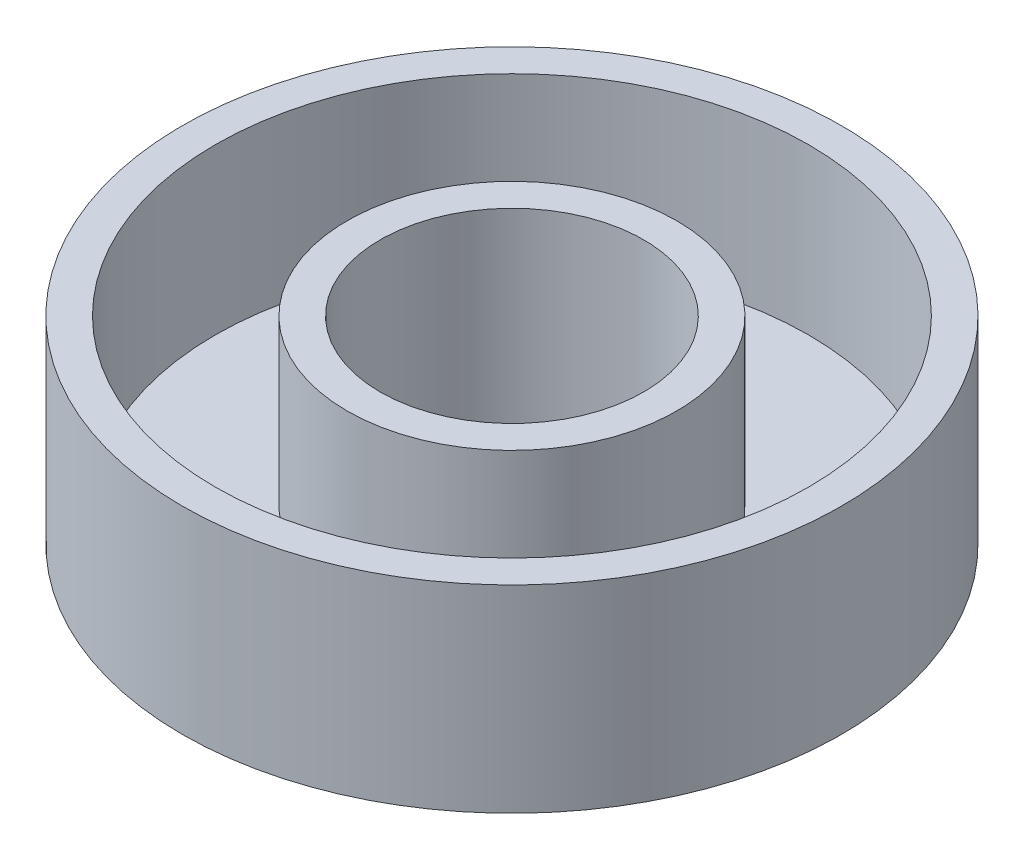
from build123d import *

# Parameters (mm, degrees)
SKETCH1_R            = 10
MAIN_EXTRUSION_DEPTH = 6
SKETCH2_R            = 4
ID_BORE_DEPTH        = 20
SKETCH3_R            = 9
SKETCH3_R_2          = 5
SEAL_RECESS_DEPTH    = 5


with BuildPart() as part:
    # Sketch1 → main extrusion (new body)
    with BuildSketch(Plane(origin=(0, 0, 0), x_dir=(1, 0, 0), z_dir=(0, 1, 0))):
        Circle(SKETCH1_R)
    extrude(amount=MAIN_EXTRUSION_DEPTH)

    # Sketch2 → ID bore (cut)
    with BuildSketch(Plane(origin=(0, 6, 0), x_dir=(1, 0, 0), z_dir=(0, 1, 0))):
        Circle(SKETCH2_R)
    extrude(amount=-ID_BORE_DEPTH, mode=Mode.SUBTRACT)

    # Sketch3 → seal recess (cut)
    with BuildSketch(Plane(origin=(0, 6, 0), x_dir=(1, 0, 0), z_dir=(0, 1, 0))):
        Circle(SKETCH3_R)
        Circle(SKETCH3_R_2, mode=Mode.SUBTRACT)
    extrude(amount=-SEAL_RECESS_DEPTH, mode=Mode.SUBTRACT)


solid = part.part
